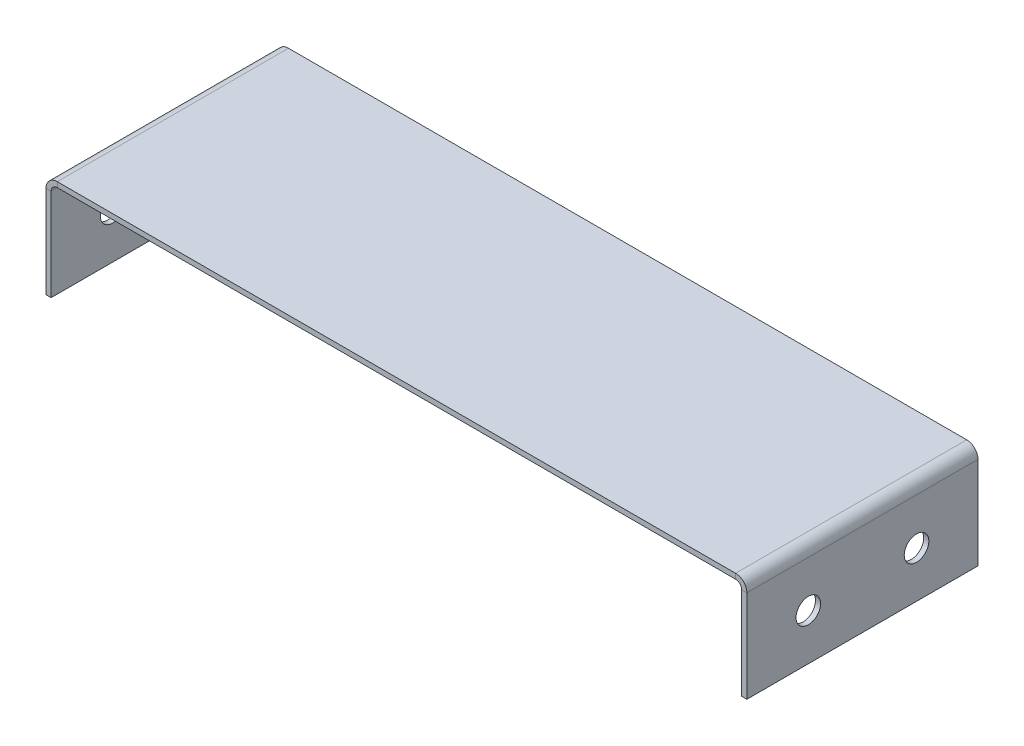
from build123d import *

# Parameters (mm, degrees)
SKETCH1_W                    = 361.95
SKETCH1_H                    = 119.38
BASE_FLANGE1_DEPTH           = 2.65684
EDGE_FLANGE1_STRIP_W         = 16.97736
EDGE_FLANGE1_STRIP_H         = 2.65684
EDGE_FLANGE1_STRIP_CUT_DEPTH = 119.38
EDGE_FLANGE1_DEPTH           = 119.38
EDGE_FLANGE2_STRIP_W         = 16.97736
EDGE_FLANGE2_STRIP_H         = 2.65684
EDGE_FLANGE2_STRIP_CUT_DEPTH = 119.38
EDGE_FLANGE2_DEPTH           = 119.38
SKETCH12_R                   = 6.35
CUT_EXTRUDE1_DEPTH           = 385.85974152


# Sheet-metal steps are written as plain solids
with BuildPart() as part:
    # Sketch1 → Base-Flange1 (new body)
    with BuildSketch(Plane(origin=(0, 0, 0), x_dir=(1, 0, 0), z_dir=(0, 1, 0))):
        with Locations((180.975, 59.69)):
            Rectangle(SKETCH1_W, SKETCH1_H)
    extrude(amount=-BASE_FLANGE1_DEPTH)

    # Edge-Flange1 strip (across the edge) → Edge-Flange1 strip cut (cut)
    with BuildSketch(Plane(origin=(0, -2.65684, 0), x_dir=(1, 0, 0), z_dir=(0, 0, -1))):
        with Locations((-2.65684, -1.32842)):
            Rectangle(EDGE_FLANGE1_STRIP_W, EDGE_FLANGE1_STRIP_H)
    extrude(amount=EDGE_FLANGE1_STRIP_CUT_DEPTH, mode=Mode.SUBTRACT)

    # Edge-Flange1 section (across the edge) → Edge-Flange1 (add)
    with BuildSketch(Plane(origin=(0, -2.65684, 0), x_dir=(1, 0, 0), z_dir=(0, 0, -1))):
        with BuildLine():
            Line((0, 3.175), (0, 50.8))
            Line((0, 50.8), (2.65684, 50.8))
            Line((2.65684, 50.8), (2.65684, 3.175))
            ThreePointArc((2.65684, 3.175), (3.58677597, 0.92993597), (5.83184, 0))
            Line((5.83184, 0), (5.83184, -2.65684))
            ThreePointArc((5.83184, -2.65684), (1.708106389, -0.948733611), (0, 3.175))
        make_face()
    extrude(amount=EDGE_FLANGE1_DEPTH)

    # Edge-Flange2 strip (across the edge) → Edge-Flange2 strip cut (cut)
    with BuildSketch(Plane(origin=(361.95, -2.65684, -119.38), x_dir=(-1, 0, 0), z_dir=(0, 0, 1))):
        with Locations((-2.65684, -1.32842)):
            Rectangle(EDGE_FLANGE2_STRIP_W, EDGE_FLANGE2_STRIP_H)
    extrude(amount=EDGE_FLANGE2_STRIP_CUT_DEPTH, mode=Mode.SUBTRACT)

    # Edge-Flange2 section (across the edge) → Edge-Flange2 (add)
    with BuildSketch(Plane(origin=(361.95, -2.65684, -119.38), x_dir=(-1, 0, 0), z_dir=(0, 0, 1))):
        with BuildLine():
            Line((0, 3.175), (0, 50.8))
            Line((0, 50.8), (2.65684, 50.8))
            Line((2.65684, 50.8), (2.65684, 3.175))
            ThreePointArc((2.65684, 3.175), (3.58677597, 0.92993597), (5.83184, 0))
            Line((5.83184, 0), (5.83184, -2.65684))
            ThreePointArc((5.83184, -2.65684), (1.708106389, -0.948733611), (0, 3.175))
        make_face()
    extrude(amount=EDGE_FLANGE2_DEPTH)

    # Sketch12 → Cut-Extrude1 (cut, through all)
    with BuildSketch(Plane.ZY):
        with Locations(Location((-87.63, -29.64434, 0), (0, 0, 270))):
            Circle(SKETCH12_R)
        with Locations(Location((-31.75, -29.64434, 0), (0, 0, 270))):
            Circle(SKETCH12_R)
    extrude(amount=-CUT_EXTRUDE1_DEPTH, mode=Mode.SUBTRACT)


solid = part.part
